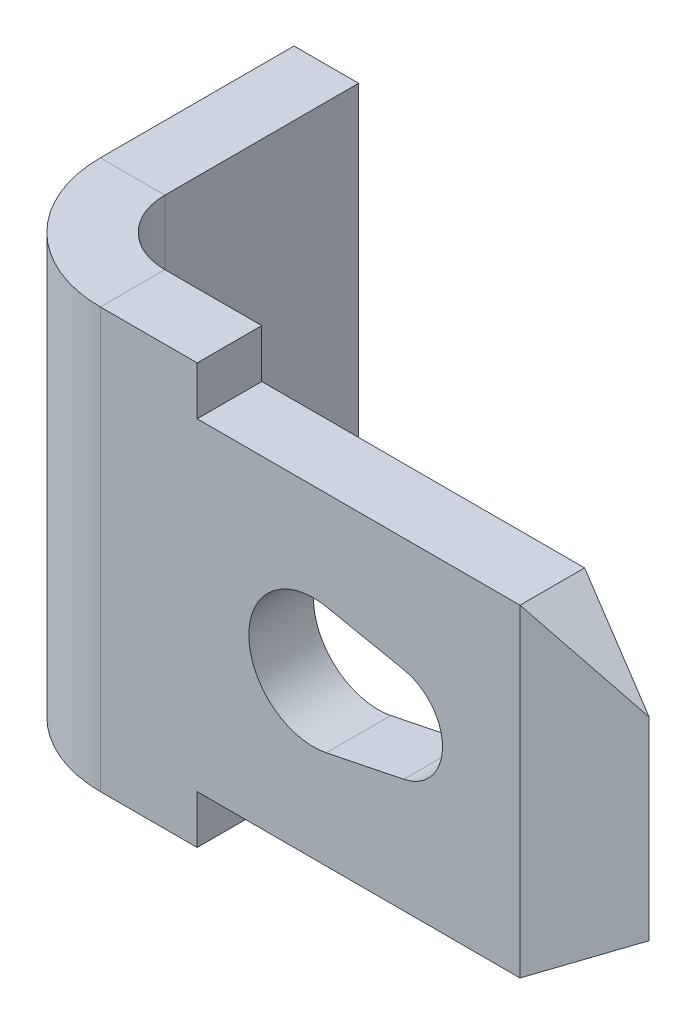
from build123d import *

# Parameters (mm, degrees)
DODANIE_WYCI_GNI_CIE1_DEPTH = 1
WYTNIJ_WYCI_GNI_CIE1_REACH  = 13.514
SZKIC8_W                    = 1
SZKIC8_H                    = 6.5
DODANIE_WYCI_GNI_CIE2_DEPTH = 4
WYTNIJ_WYCI_GNI_CIE2_REACH  = 14.148
SZKIC9_W                    = 1
SZKIC9_H                    = 6.5
KONWERTUJ_START             = -3.25
KONWERTUJ_BRY_2_DEPTH       = 6.5
KONWERTUJ_BRY_2_2_DEPTH     = 6.5
WYTNIJ_WYCI_GNI_CIE3_REACH  = 15.041


# Read off the part's stored shape, not the designer's step: Konwertuj bryłę2
with BuildPart() as part:
    # Szkic1 → Dodanie-wyciągnięcie1 (new body)
    with BuildSketch(Plane.XY):
        Polygon((0, -3.25), (0, 3.25), (4.5, 3.25), (4.5, 2.5), (9.5, 2.5), (11, 1.5), (11, -1.5), (9.5, -2.5), (4.5, -2.5), (4.5, -3.25), align=None)
    extrude(amount=DODANIE_WYCI_GNI_CIE1_DEPTH)

    # Szkic2 → Wytnij-wyciągnięcie1 (cut, up to next)
    with BuildSketch(Plane.XY.offset(1), mode=Mode.PRIVATE) as wytnij_wyci_gni_cie1_sk1:
        with BuildLine():
            Line((6.5, 0.979795897), (7.7, 0.734846923))
            ThreePointArc((7.7, 0.734846923), (8.3, 0), (7.7, -0.734846923))
            Line((7.7, -0.734846923), (6.5, -0.979795897))
            ThreePointArc((6.5, -0.979795897), (5.3, 0), (6.5, 0.979795897))
        make_face()
    wytnij_wyci_gni_cie1_tool1 = extrude(wytnij_wyci_gni_cie1_sk1.sketch, amount=-WYTNIJ_WYCI_GNI_CIE1_REACH, mode=Mode.PRIVATE) & part.part
    add(wytnij_wyci_gni_cie1_tool1.solids().sort_by_distance((6.737463, 0, 1))[0], mode=Mode.SUBTRACT)

    # Szkic8 → Dodanie-wyciągnięcie2 (add)
    with BuildSketch(Plane(origin=(0, 0, 0), x_dir=(-1, 0, 0), z_dir=(0, 0, -1))):
        with Locations((-1.5, 0)):
            Rectangle(SZKIC8_W, SZKIC8_H)
    extrude(amount=DODANIE_WYCI_GNI_CIE2_DEPTH)

    # Szkic9 → Wytnij-wyciągnięcie2 (cut, up to next)
    with BuildSketch(Plane(origin=(0, 0, 0), x_dir=(-1, 0, 0), z_dir=(0, 0, -1)), mode=Mode.PRIVATE) as wytnij_wyci_gni_cie2_sk1:
        with Locations((-0.5, 0)):
            Rectangle(SZKIC9_W, SZKIC9_H)
    wytnij_wyci_gni_cie2_tool1 = extrude(wytnij_wyci_gni_cie2_sk1.sketch, amount=-WYTNIJ_WYCI_GNI_CIE2_REACH, mode=Mode.PRIVATE) & part.part
    add(wytnij_wyci_gni_cie2_tool1.solids().sort_by_distance((0.5, 0, 0))[0], mode=Mode.SUBTRACT)

    # Konwertuj bryłę2 outline → Konwertuj bryłę2 (cut)
    with BuildSketch(Plane(origin=(0, 0, 0), x_dir=(1, 0, 0), z_dir=(0, 1, 0)).offset(KONWERTUJ_START)):
        with BuildLine():
            Line((1, -1), (3, -1))
            ThreePointArc((3, -1), (1.585786438, -0.414213562), (1, 1))
            Line((1, 1), (1, -1))
        make_face()
    extrude(amount=KONWERTUJ_BRY_2_DEPTH, mode=Mode.SUBTRACT)

    # Konwertuj bry_2 2 outline → Konwertuj bry_2 2 (add)
    with BuildSketch(Plane(origin=(0, 0, 0), x_dir=(1, 0, 0), z_dir=(0, 1, 0)).offset(KONWERTUJ_START)):
        with BuildLine():
            Line((2, 0), (3, 0))
            ThreePointArc((3, 0), (2.292893219, 0.292893219), (2, 1))
            Line((2, 1), (2, 0))
        make_face()
    extrude(amount=KONWERTUJ_BRY_2_2_DEPTH)

    # Wytnij-wyciągnięcie3: up to this plane
    wytnij_wyci_gni_cie3_end = Plane(origin=(9.5, 2.5, 0), z_dir=(-0.5547001962252293, -0.8320502943378437, 0))
    # Szkic14 → Wytnij-wyciągnięcie3 (cut, up to the surface)
    with BuildSketch(Plane.XZ.offset(2.5), mode=Mode.PRIVATE) as wytnij_wyci_gni_cie3_sk1:
        Polygon((11, 0), (11, 0.5), (9.5, 0), align=None)
    wytnij_wyci_gni_cie3_tool1 = split(extrude(wytnij_wyci_gni_cie3_sk1.sketch, amount=-WYTNIJ_WYCI_GNI_CIE3_REACH, mode=Mode.PRIVATE), bisect_by=wytnij_wyci_gni_cie3_end, keep=Keep.BOTH, mode=Mode.PRIVATE)
    add(wytnij_wyci_gni_cie3_tool1.solids().sort_by_distance((10.5, -2.5, 0.166667))[0], mode=Mode.SUBTRACT)
    # Szkic14 → Wytnij-wyciągnięcie3 (cut, up to the surface)
    with BuildSketch(Plane.XZ.offset(2.5), mode=Mode.PRIVATE) as wytnij_wyci_gni_cie3_sk2:
        Polygon((11, 0.5), (11, 1), (9.5, 1), align=None)
    wytnij_wyci_gni_cie3_tool2 = split(extrude(wytnij_wyci_gni_cie3_sk2.sketch, amount=-WYTNIJ_WYCI_GNI_CIE3_REACH, mode=Mode.PRIVATE), bisect_by=wytnij_wyci_gni_cie3_end, keep=Keep.BOTH, mode=Mode.PRIVATE)
    add(wytnij_wyci_gni_cie3_tool2.solids().sort_by_distance((10.5, -2.5, 0.833333))[0], mode=Mode.SUBTRACT)


solid = part.part
